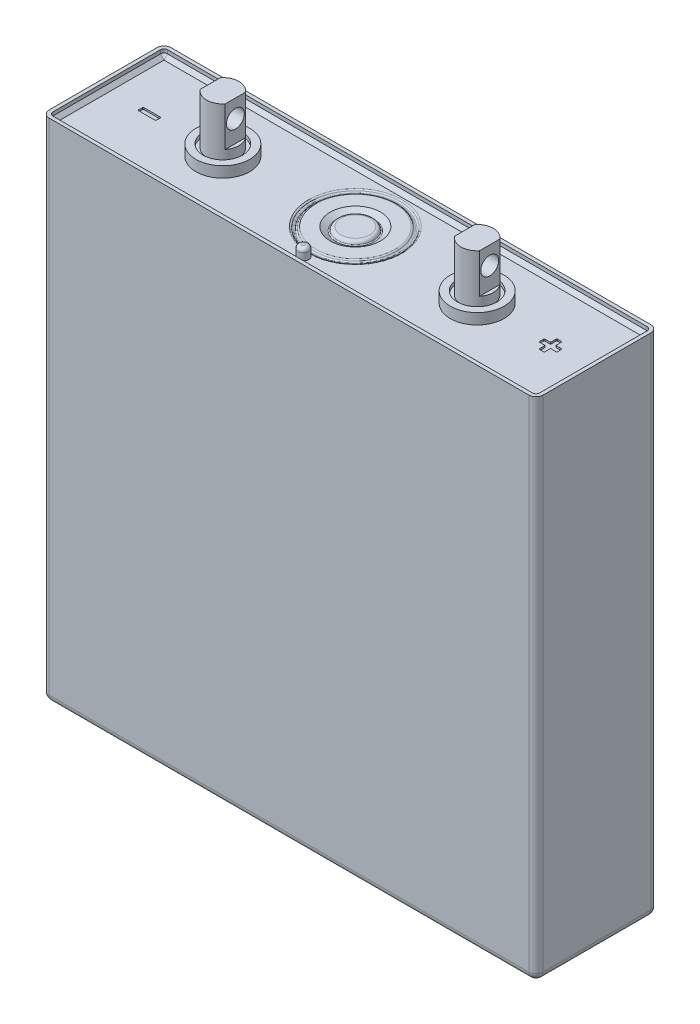
from build123d import *

# Parameters (mm, degrees)
SKETCH1_W           = 137.7
SKETCH1_H           = 34
BOSS_EXTRUDE1_DEPTH = 141.3
FILLET1_R           = 2
CUT_EXTRUDE1_DEPTH  = 2
CHAMFER1_SIZE       = 1
SKETCH3_R           = 7.5
BOSS_EXTRUDE2_DEPTH = 3
SKETCH4_R           = 5.5
CUT_EXTRUDE2_DEPTH  = 1
SKETCH5_R           = 4.5
BOSS_EXTRUDE3_DEPTH = 13.8
SKETCH6_W           = 1
SKETCH6_H           = 11
CUT_EXTRUDE3_DEPTH  = 171.54422447
SKETCH7_R           = 2.5
CUT_EXTRUDE4_DEPTH  = 13.8
SKETCH8_W           = 1.5
SKETCH8_H           = 1.5
CUT_EXTRUDE5_DEPTH  = 0.5
SKETCH9_R           = 12.5
SKETCH9_R_2         = 11.5
CUT_EXTRUDE6_DEPTH  = 0.5
SKETCH10_R          = 1.5
BOSS_EXTRUDE4_DEPTH = 3
FILLET2_R           = 1
SKETCH12_W          = 2
SKETCH12_H          = 0.813567547
FILLET3_R           = 1
FILLET4_R           = 0.5
FILLET5_R           = 0.5


with BuildPart() as part:
    # Sketch1 → Boss-Extrude1 (new body)
    with BuildSketch(Plane(origin=(0, 0, 0), x_dir=(1, 0, 0), z_dir=(0, 1, 0))):
        Rectangle(SKETCH1_W, SKETCH1_H)
    extrude(amount=BOSS_EXTRUDE1_DEPTH)

    # Fillet1
    fillet1_edges = [part.edges().sort_by_distance(p)[0] for p in [
        (0, 0, -17),
        (68.85, 0, 0),
        (0, 0, 17),
        (-68.85, 0, 0),
        (-68.85, 70.65, -17),
        (68.85, 70.65, -17),
        (68.85, 70.65, 17),
        (-68.85, 70.65, 17),
    ]]
    fillet(fillet1_edges, radius=FILLET1_R)

    # Sketch2 → Cut-Extrude1 (cut)
    with BuildSketch(Plane(origin=(0, 141.3, 0), x_dir=(1, 0, 0), z_dir=(0, 1, 0))):
        with BuildLine():
            Line((-66.85, -16), (66.85, -16))
            ThreePointArc((66.85, -16), (67.557106781, -15.707106781), (67.85, -15))
            Line((67.85, -15), (67.85, 15))
            ThreePointArc((67.85, 15), (67.557106781, 15.707106781), (66.85, 16))
            Line((66.85, 16), (-66.85, 16))
            ThreePointArc((-66.85, 16), (-67.557106781, 15.707106781), (-67.85, 15))
            Line((-67.85, 15), (-67.85, -15))
            ThreePointArc((-67.85, -15), (-67.557106781, -15.707106781), (-66.85, -16))
        make_face()
    extrude(amount=-CUT_EXTRUDE1_DEPTH, mode=Mode.SUBTRACT)

    # Chamfer1
    chamfer1_edges = [part.edges().sort_by_distance(p)[0] for p in [
        (-67.557106781, 139.3, 15.707106781),
        (-67.85, 139.3, 0),
        (-67.557106781, 139.3, -15.707106781),
        (0, 139.3, -16),
        (67.557106781, 139.3, -15.707106781),
        (67.85, 139.3, 0),
        (67.557106781, 139.3, 15.707106781),
        (0, 139.3, 16),
    ]]
    chamfer(chamfer1_edges, length=CHAMFER1_SIZE - 0.0001)  # a hair under: the kernel refuses the full size

    # Sketch3 → Boss-Extrude2 (add)
    with BuildSketch(Plane(origin=(0, 139.3, 0), x_dir=(1, 0, 0), z_dir=(0, 1, 0))):
        with Locations(Location((-35.45, 0, 0), (0, 0, 270))):
            Circle(SKETCH3_R)
        with Locations(Location((35.45, 0, 0), (0, 0, 270))):
            Circle(SKETCH3_R)
    extrude(amount=BOSS_EXTRUDE2_DEPTH)

    # Sketch4 → Cut-Extrude2 (cut)
    with BuildSketch(Plane(origin=(0, 142.3, 0), x_dir=(1, 0, 0), z_dir=(0, 1, 0))):
        with Locations(Location((-35.45, 0, 0), (0, 0, 270))):
            Circle(SKETCH4_R)
        with Locations(Location((35.45, 0, 0), (0, 0, 270))):
            Circle(SKETCH4_R)
    extrude(amount=-CUT_EXTRUDE2_DEPTH, mode=Mode.SUBTRACT)

    # Sketch5 → Boss-Extrude3 (add)
    with BuildSketch(Plane(origin=(0, 141.3, 0), x_dir=(1, 0, 0), z_dir=(0, 1, 0))):
        with Locations(Location((-35.45, 0, 0), (0, 0, 90))):
            Circle(SKETCH5_R)
    boss_extrude3 = extrude(amount=BOSS_EXTRUDE3_DEPTH)

    # Sketch6 → Cut-Extrude3 (cut, symmetric)
    with BuildSketch(Plane.XY):
        with Locations((-31.45, 149.6)):
            Rectangle(SKETCH6_W, SKETCH6_H)
        with Locations((-39.45, 149.6)):
            Rectangle(SKETCH6_W, SKETCH6_H)
    cut_extrude3 = extrude(amount=CUT_EXTRUDE3_DEPTH, both=True, mode=Mode.SUBTRACT)

    # Sketch7 → Cut-Extrude4 (cut)
    with BuildSketch(Plane(origin=(-31.95, 0, 0), x_dir=(0, 0, -1), z_dir=(1, 0, 0))):
        with Locations((0, 150.1)):
            Circle(SKETCH7_R)
    cut_extrude4 = extrude(amount=-CUT_EXTRUDE4_DEPTH, mode=Mode.SUBTRACT)

    # Mirror1: Boss-Extrude3, Cut-Extrude3, Cut-Extrude4 across plane
    add(boss_extrude3.mirror(Plane(origin=(0, 0, 0), x_dir=(0, 0, 1), z_dir=(1, 0, 0))))
    add(cut_extrude3.mirror(Plane(origin=(0, 0, 0), x_dir=(0, 0, 1), z_dir=(1, 0, 0))), mode=Mode.SUBTRACT)
    add(cut_extrude4.mirror(Plane(origin=(0, 0, 0), x_dir=(0, 0, 1), z_dir=(1, 0, 0))), mode=Mode.SUBTRACT)

    # Sketch8 → Cut-Extrude5 (cut)
    with BuildSketch(Plane(origin=(0, 139.3, 0), x_dir=(1, 0, 0), z_dir=(0, 1, 0))):
        with BuildLine():
            Line((55.15, 0.75), (56.65, 0.75))
            Line((56.65, 0.75), (56.65, 2.25))
            ThreePointArc((56.65, 2.25), (56.576776695, 2.426776695), (56.4, 2.5))
            Line((56.4, 2.5), (55.4, 2.5))
            ThreePointArc((55.4, 2.5), (55.223223305, 2.426776695), (55.15, 2.25))
            Line((55.15, 2.25), (55.15, 0.75))
        make_face()
        with Locations((55.9, 0)):
            Rectangle(SKETCH8_W, SKETCH8_H)
        with BuildLine():
            Line((53.65, -0.75), (55.15, -0.75))
            Line((55.15, -0.75), (55.15, 0.75))
            Line((55.15, 0.75), (53.65, 0.75))
            ThreePointArc((53.65, 0.75), (53.473223305, 0.676776695), (53.4, 0.5))
            Line((53.4, 0.5), (53.4, -0.5))
            ThreePointArc((53.4, -0.5), (53.473223305, -0.676776695), (53.65, -0.75))
        make_face()
        with BuildLine():
            Line((56.65, -0.75), (58.15, -0.75))
            ThreePointArc((58.15, -0.75), (58.326776695, -0.676776695), (58.4, -0.5))
            Line((58.4, -0.5), (58.4, 0.5))
            ThreePointArc((58.4, 0.5), (58.326776695, 0.676776695), (58.15, 0.75))
            Line((58.15, 0.75), (56.65, 0.75))
            Line((56.65, 0.75), (56.65, -0.75))
        make_face()
        with BuildLine():
            Line((56.65, -2.25), (56.65, -0.75))
            Line((56.65, -0.75), (55.15, -0.75))
            Line((55.15, -0.75), (55.15, -2.25))
            ThreePointArc((55.15, -2.25), (55.223223305, -2.426776695), (55.4, -2.5))
            Line((55.4, -2.5), (56.4, -2.5))
            ThreePointArc((56.4, -2.5), (56.576776695, -2.426776695), (56.65, -2.25))
        make_face()
        with BuildLine():
            Line((-53.65, 0.75), (-58.15, 0.75))
            ThreePointArc((-58.15, 0.75), (-58.326776695, 0.676776695), (-58.4, 0.5))
            Line((-58.4, 0.5), (-58.4, -0.5))
            ThreePointArc((-58.4, -0.5), (-58.326776695, -0.676776695), (-58.15, -0.75))
            Line((-58.15, -0.75), (-53.65, -0.75))
            ThreePointArc((-53.65, -0.75), (-53.473223305, -0.676776695), (-53.4, -0.5))
            Line((-53.4, -0.5), (-53.4, 0.5))
            ThreePointArc((-53.4, 0.5), (-53.473223305, 0.676776695), (-53.65, 0.75))
        make_face()
    extrude(amount=-CUT_EXTRUDE5_DEPTH, mode=Mode.SUBTRACT)

    # Sketch9 → Cut-Extrude6 (cut)
    with BuildSketch(Plane(origin=(0, 139.3, 0), x_dir=(1, 0, 0), z_dir=(0, 1, 0))):
        with Locations(Location((0, 1.5, 0), (0, 0, 270))):
            Circle(SKETCH9_R)
        with Locations(Location((0, 1.5, 0), (0, 0, 270))):
            Circle(SKETCH9_R_2, mode=Mode.SUBTRACT)
    extrude(amount=-CUT_EXTRUDE6_DEPTH, mode=Mode.SUBTRACT)

    # Sketch10 → Boss-Extrude4 (add)
    with BuildSketch(Plane(origin=(0, 139.3, 0), x_dir=(1, 0, 0), z_dir=(0, 1, 0))):
        with Locations(Location((0, -13, 0), (0, 0, 270))):
            Circle(SKETCH10_R)
    extrude(amount=BOSS_EXTRUDE4_DEPTH)

    # Fillet2
    fillet2_edges = [part.edges().sort_by_distance(p)[0] for p in [
        (0, 142.3, 11.5),
    ]]
    fillet(fillet2_edges, radius=FILLET2_R)

    # Sketch12 → Cut-Revolve1 (revolve, cut)
    with BuildSketch(Plane.XY.offset(-1.5), mode=Mode.PRIVATE) as cut_revolve1_sk:
        with BuildLine():
            ThreePointArc((-5, 138.55), (-5.126407718, 138.332686982), (-5.377799583, 138.335134306))
            Line((-5.377799583, 138.335134306), (-7, 139.3))
            Line((-7, 139.3), (-5, 139.3))
            Line((-5, 139.3), (-5, 138.55))
        make_face()
        with Locations((-6, 139.706783774)):
            Rectangle(SKETCH12_W, SKETCH12_H)
    revolve(cut_revolve1_sk.sketch.rotate(Axis((0, 0, -1.5), (0, 1, 0)), 270), axis=Axis((0, 0, -1.5), (0, 1, 0)), mode=Mode.SUBTRACT)

    # Fillet3
    fillet3_edges = [part.edges().sort_by_distance(p)[0] for p in [
        (0, 139.3, 3.5),
    ]]
    fillet(fillet3_edges, radius=FILLET3_R)

    # Fillet4
    fillet4_edges = [part.edges().sort_by_distance(p)[0] for p in [
        (0, 139.3, -14),
        (0, 139.3, -13),
    ]]
    fillet(fillet4_edges, radius=FILLET4_R - 0.0001)  # a hair under: the kernel refuses the full size

    # Fillet5
    fillet5_edges = [part.edges().sort_by_distance(p)[0] for p in [
        (0, 138.8, -14),
        (0, 138.8, -13),
    ]]
    fillet(fillet5_edges, radius=FILLET5_R)


solid = part.part
